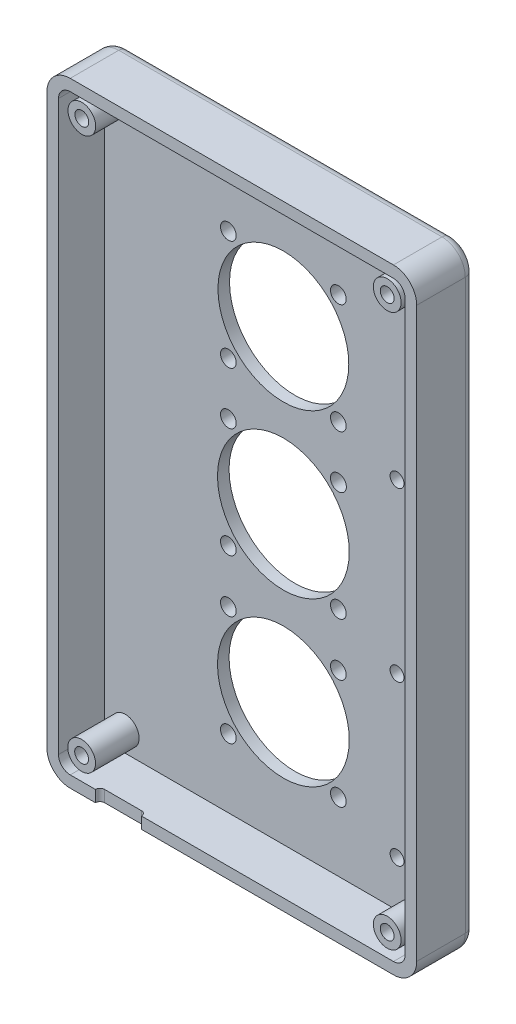
from build123d import *

# Parameters (mm, degrees)
BOSS_EXTRU_1_DEPTH      = 10
COQUE1_T                = 2.5
CONG_1_R                = 2
ESQUISSE3_R             = 3
ESQUISSE3_R_2           = 1.5
BOSS_EXTRU_2_DEPTH      = 9.43
ESQUISSE4_W             = 9.967172774
ESQUISSE4_H             = 2.559848265
ENL_V_MAT_EXTRU_2_DEPTH = 1
CONG_4_R                = 1
ESQUISSE5_R             = 1.7
ESQUISSE5_R_2           = 1.728785314
ESQUISSE5_R_3           = 14.25
ESQUISSE5_R_4           = 14.15
ENL_V_MAT_EXTRU_3_DEPTH = 10
ESQUISSE6_R             = 1.5
ENL_V_MAT_EXTRU_4_DEPTH = 10


# Some blends are built 0.0001 mm under size
with BuildPart() as part:
    # Esquisse1 → Boss.-Extru.1 (new body)
    with BuildSketch(Plane.XY):
        with BuildLine():
            Line((-34.96, -64), (34.96, -64))
            ThreePointArc((34.96, -64), (36.756051224, -63.256051224), (37.5, -61.46))
            Line((37.5, -61.46), (37.5, 61.46))
            ThreePointArc((37.5, 61.46), (36.756051224, 63.256051224), (34.96, 64))
            Line((34.96, 64), (-34.96, 64))
            ThreePointArc((-34.96, 64), (-36.756051224, 63.256051224), (-37.5, 61.46))
            Line((-37.5, 61.46), (-37.5, -61.46))
            ThreePointArc((-37.5, -61.46), (-36.756051224, -63.256051224), (-34.96, -64))
        make_face()
    extrude(amount=BOSS_EXTRU_1_DEPTH)

    # Coque1
    coque1_openings = [part.faces().sort_by_distance(p)[0] for p in [
        (0, 0, 10),
    ]]
    offset(amount=COQUE1_T, openings=coque1_openings, kind=Kind.INTERSECTION)

    # Congé1
    # the kernel refuses this fillet: 2 mm, written as the material it takes off along each edge
    with BuildSketch(Plane(origin=(34.96, 66.5, -2.5), x_dir=(0, 0, 1), z_dir=(-1, 0, 0)), Plane(origin=(-34.96, -66.5, -2.5), x_dir=(0, 0, 1), z_dir=(1, 0, 0))) as cong_1_piece_1:
        with BuildLine():
            CenterArc((CONG_1_R, -CONG_1_R), CONG_1_R, 90, 90)
            Line((0, -CONG_1_R), (0, 0))
            Line((0, 0), (CONG_1_R, 0))
        make_face()
    extrude(amount=69.92, mode=Mode.SUBTRACT)
    with BuildSketch(Plane(origin=(34.96, 61.46, -2.5), x_dir=(0, 1, 0), z_dir=(-1, 0, 0))) as cong_1_piece_2:
        with BuildLine():
            CenterArc((5.04 - CONG_1_R, -CONG_1_R), CONG_1_R, 0, 90)
            Line((5.04 - CONG_1_R, 0), (5.04, 0))
            Line((5.04, 0), (5.04, -CONG_1_R))
        make_face()
    revolve(axis=Axis((34.96, 61.46, -2.5), (0, 0, -1)), revolution_arc=90, mode=Mode.SUBTRACT)
    with BuildSketch(Plane(origin=(40, -61.46, -2.5), x_dir=(0, 0, 1), z_dir=(0, 1, 0)), Plane(origin=(-40, 61.46, -2.5), x_dir=(0, 0, 1), z_dir=(0, -1, 0))) as cong_1_piece_3:
        with BuildLine():
            CenterArc((CONG_1_R, -CONG_1_R), CONG_1_R, 90, 90)
            Line((0, -CONG_1_R), (0, 0))
            Line((0, 0), (CONG_1_R, 0))
        make_face()
    extrude(amount=122.92, mode=Mode.SUBTRACT)
    with BuildSketch(Plane(origin=(34.96, -61.46, -2.5), x_dir=(1, 0, 0), z_dir=(0, 1, 0))) as cong_1_piece_4:
        with BuildLine():
            CenterArc((5.04 - CONG_1_R, -CONG_1_R), CONG_1_R, 0, 90)
            Line((5.04 - CONG_1_R, 0), (5.04, 0))
            Line((5.04, 0), (5.04, -CONG_1_R))
        make_face()
    revolve(axis=Axis((34.96, -61.46, -2.5), (0, 0, -1)), revolution_arc=90, mode=Mode.SUBTRACT)
    with BuildSketch(Plane(origin=(-34.96, -61.46, -2.5), x_dir=(0, -1, 0), z_dir=(1, 0, 0))) as cong_1_piece_5:
        with BuildLine():
            CenterArc((5.04 - CONG_1_R, -CONG_1_R), CONG_1_R, 0, 90)
            Line((5.04 - CONG_1_R, 0), (5.04, 0))
            Line((5.04, 0), (5.04, -CONG_1_R))
        make_face()
    revolve(axis=Axis((-34.96, -61.46, -2.5), (0, 0, -1)), revolution_arc=90, mode=Mode.SUBTRACT)
    with BuildSketch(Plane(origin=(-34.96, 61.46, -2.5), x_dir=(-1, 0, 0), z_dir=(0, -1, 0))) as cong_1_piece_6:
        with BuildLine():
            CenterArc((5.04 - CONG_1_R, -CONG_1_R), CONG_1_R, 0, 90)
            Line((5.04 - CONG_1_R, 0), (5.04, 0))
            Line((5.04, 0), (5.04, -CONG_1_R))
        make_face()
    revolve(axis=Axis((-34.96, 61.46, -2.5), (0, 0, -1)), revolution_arc=90, mode=Mode.SUBTRACT)

    # Esquisse3 → Boss.-Extru.2 (add)
    # profile 1 of 4: a face of its own
    with BuildSketch(Plane.XY):
        with Locations(Location((-33.02, 59.69, 0), (0, 0, 180))):
            Circle(ESQUISSE3_R)
        with Locations(Location((-33.02, 59.69, 0), (0, 0, 180))):
            Circle(ESQUISSE3_R_2, mode=Mode.SUBTRACT)
    # profile 2 of 4: a face of its own
    with BuildSketch(Plane.XY):
        with Locations(Location((33.046544, 59.69, 0), (0, 0, 180))):
            Circle(ESQUISSE3_R)
        with Locations(Location((33.046544, 59.69, 0), (0, 0, 180))):
            Circle(ESQUISSE3_R_2, mode=Mode.SUBTRACT)
    # profile 3 of 4: a face of its own
    with BuildSketch(Plane.XY):
        with Locations(Location((-33.06, -59.69, 0), (0, 0, 180))):
            Circle(ESQUISSE3_R)
        with Locations(Location((-33.06, -59.69, 0), (0, 0, 180))):
            Circle(ESQUISSE3_R_2, mode=Mode.SUBTRACT)
    # profile 4 of 4: a face of its own
    with BuildSketch(Plane.XY):
        with Locations(Location((33.046483, -59.75896698, 0), (0, 0, 180))):
            Circle(ESQUISSE3_R)
        with Locations(Location((33.046483, -59.75896698, 0), (0, 0, 180))):
            Circle(ESQUISSE3_R_2, mode=Mode.SUBTRACT)
    extrude(amount=BOSS_EXTRU_2_DEPTH)

    # Esquisse4 → Enlèv. mat.-Extru.2 (cut)
    with BuildSketch(Plane.XY.offset(10)):
        with Locations((-24.5364, -65.279924132)):
            Rectangle(ESQUISSE4_W, ESQUISSE4_H)
    extrude(amount=-ENL_V_MAT_EXTRU_2_DEPTH, mode=Mode.SUBTRACT)

    # Congé4
    cong_4_edges = [part.edges().sort_by_distance(p)[0] for p in [
        (-19.552813613, -65.25, 9),
        (-29.519986387, -65.25, 9),
    ]]
    fillet(cong_4_edges, radius=CONG_4_R - 0.0001)  # a hair under: the kernel refuses the full size

    # Esquisse5 → Enlèv. mat.-Extru.3 (cut)
    with BuildSketch(Plane(origin=(0, 0, -2.5), x_dir=(-1, 0, 0), z_dir=(0, 0, -1))):
        with Locations((-13.048991778, 44.95809385)):
            Circle(ESQUISSE5_R)
        with Locations((10.751008222, 44.95809385)):
            Circle(ESQUISSE5_R)
        with Locations((10.751008222, 21.15809385)):
            Circle(ESQUISSE5_R)
        with Locations((-13.048991778, 21.15809385)):
            Circle(ESQUISSE5_R)
        with Locations((-13.048991778, 9.795871187)):
            Circle(ESQUISSE5_R_2)
        with Locations((10.751008222, 9.824656501)):
            Circle(ESQUISSE5_R)
        with Locations((10.751008222, -13.975343499)):
            Circle(ESQUISSE5_R)
        with Locations((-13.048991778, -13.975343499)):
            Circle(ESQUISSE5_R)
        with Locations((-13.048991778, -25.396338685)):
            Circle(ESQUISSE5_R)
        with Locations((10.751008222, -25.396338685)):
            Circle(ESQUISSE5_R)
        with Locations((10.751008222, -49.196338685)):
            Circle(ESQUISSE5_R)
        with Locations((-13.048991778, -49.196338685)):
            Circle(ESQUISSE5_R)
        with Locations((-1.148991778, -37.296338685)):
            Circle(ESQUISSE5_R_3)
        with Locations((-1.148991778, -2.075343499)):
            Circle(ESQUISSE5_R_3)
        with Locations((-1.148991778, 33.05809385)):
            Circle(ESQUISSE5_R_4)
    extrude(amount=-ENL_V_MAT_EXTRU_3_DEPTH, mode=Mode.SUBTRACT)

    # Esquisse6 → Enlèv. mat.-Extru.4 (cut)
    with BuildSketch(Plane.XY):
        with Locations((25.740105724, 16.653070924)):
            Circle(ESQUISSE6_R)
        with Locations((25.740105724, -19.683006416)):
            Circle(ESQUISSE6_R)
        with Locations((25.740105724, -54.120805544)):
            Circle(ESQUISSE6_R)
    extrude(amount=-ENL_V_MAT_EXTRU_4_DEPTH, mode=Mode.SUBTRACT)


solid = part.part
